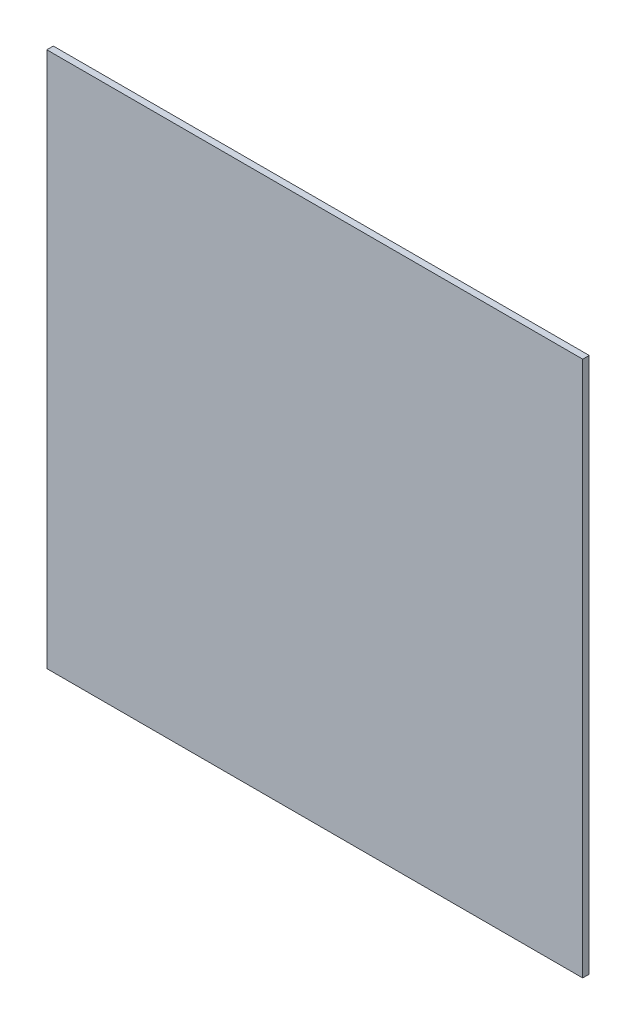
from build123d import *

# Parameters (mm, degrees)
SKETCH2_W           = 330
SKETCH2_H           = 330
BOSS_EXTRUDE2_DEPTH = 4


with BuildPart() as part:
    # Sketch2 → Boss-Extrude2 (new body)
    with BuildSketch(Plane.XY):
        Rectangle(SKETCH2_W, SKETCH2_H)
    extrude(amount=BOSS_EXTRUDE2_DEPTH)


solid = part.part
